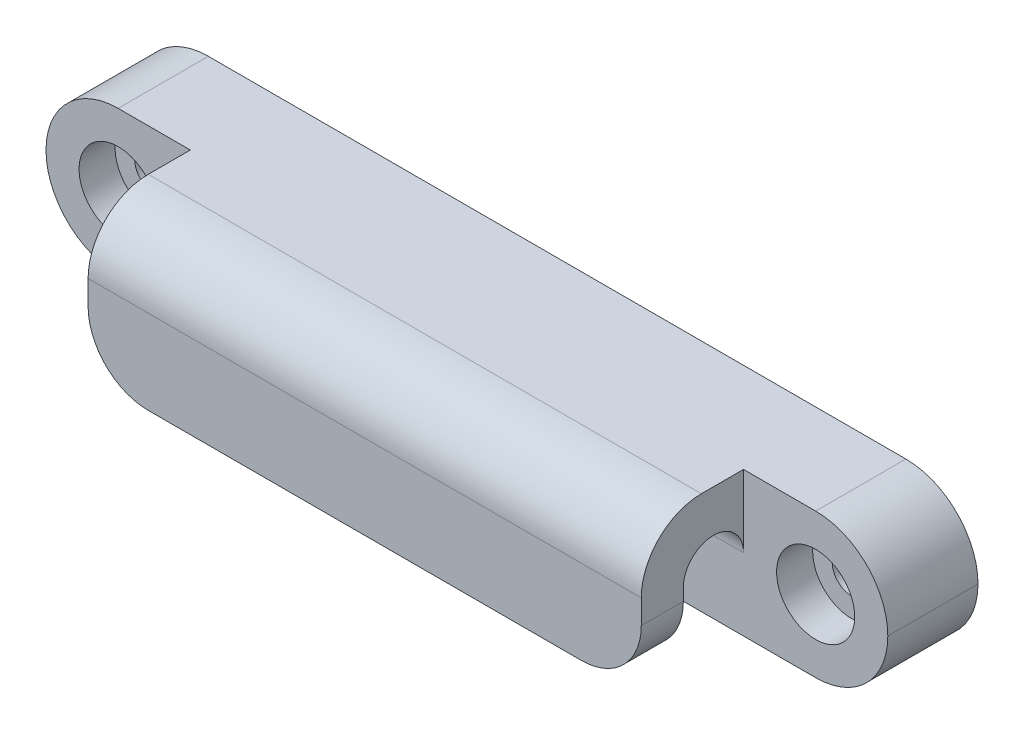
from build123d import *

# Parameters (mm, degrees)
SKETCH1_W           = 70
SKETCH1_H           = 12
BOSS_EXTRUDE1_DEPTH = 16
SKETCH2_R           = 2.5
CUT_EXTRUDE1_DEPTH  = 73.055534139
SKETCH3_W           = 5
SKETCH3_H           = 7.661898901
CUT_EXTRUDE2_DEPTH  = 73.055534139
SKETCH8_W           = 12
SKETCH8_H           = 12
CUT_EXTRUDE6_DEPTH  = 8.5
FILLET2_R           = 5
SKETCH9_R           = 1.625
CUT_EXTRUDE7_DEPTH  = 37.513696061
SKETCH10_R          = 3.25
CUT_EXTRUDE8_DEPTH  = 3
FILLET3_R           = 6
FILLET5_R           = 5


with BuildPart() as part:
    # Sketch1 → Boss-Extrude1 (new body)
    with BuildSketch(Plane.XY):
        Rectangle(SKETCH1_W, SKETCH1_H)
    extrude(amount=BOSS_EXTRUDE1_DEPTH)

    # Sketch2 → Cut-Extrude1 (cut, through all)
    with BuildSketch(Plane.ZY.offset(35)):
        with Locations((10, 0)):
            Circle(SKETCH2_R)
    extrude(amount=-CUT_EXTRUDE1_DEPTH, mode=Mode.SUBTRACT)

    # Sketch3 → Cut-Extrude2 (cut, through all)
    with BuildSketch(Plane.ZY.offset(35)):
        with Locations((10, -3.830949451)):
            Rectangle(SKETCH3_W, SKETCH3_H)
    extrude(amount=-CUT_EXTRUDE2_DEPTH, mode=Mode.SUBTRACT)

    # Sketch8 → Cut-Extrude6 (cut)
    with BuildSketch(Plane.XY.offset(16)):
        with Locations((-29, 0)):
            Rectangle(SKETCH8_W, SKETCH8_H)
        with Locations((29, 0)):
            Rectangle(SKETCH8_W, SKETCH8_H)
    extrude(amount=-CUT_EXTRUDE6_DEPTH, mode=Mode.SUBTRACT)

    # Fillet2
    fillet2_edges = [part.edges().sort_by_distance(p)[0] for p in [
        (0, 6, 16),
    ]]
    fillet(fillet2_edges, radius=FILLET2_R)

    # Sketch9 → Cut-Extrude7 (cut, through all)
    with BuildSketch(Plane.XY.offset(7.5)):
        with Locations((-29, 0)):
            Circle(SKETCH9_R)
        with Locations(Location((29, 0, 0), (0, 0, 180))):
            Circle(SKETCH9_R)
    extrude(amount=-CUT_EXTRUDE7_DEPTH, mode=Mode.SUBTRACT)

    # Sketch10 → Cut-Extrude8 (cut)
    with BuildSketch(Plane.XY.offset(7.5)):
        with Locations((-29, 0)):
            Circle(SKETCH10_R)
        with Locations(Location((29, 0, 0), (0, 0, 180))):
            Circle(SKETCH10_R)
    extrude(amount=-CUT_EXTRUDE8_DEPTH, mode=Mode.SUBTRACT)

    # Fillet3
    fillet3_edges = [part.edges().sort_by_distance(p)[0] for p in [
        (35, 6, 3.75),
        (35, -6, 3.75),
        (-35, 6, 3.75),
        (-35, -6, 3.75),
    ]]
    fillet(fillet3_edges, radius=FILLET3_R - 0.0001)  # a hair under: the kernel refuses the full size

    # Fillet5
    fillet5_edges = [part.edges().sort_by_distance(p)[0] for p in [
        (-23, -6, 14.25),
        (23, -6, 14.25),
    ]]
    fillet(fillet5_edges, radius=FILLET5_R)


solid = part.part
